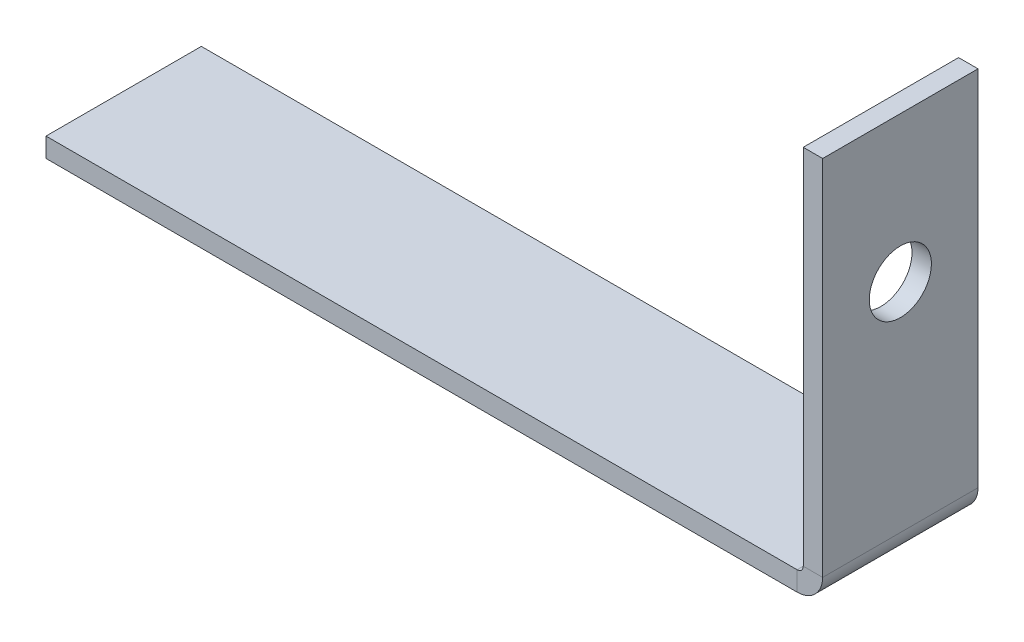
from build123d import *

# Parameters (mm, degrees)
SKETCH2_W                    = 127
SKETCH2_H                    = 25.4
BASE_FLANGE1_DEPTH           = 3.175
EDGE_FLANGE1_STRIP_W         = 14.7
EDGE_FLANGE1_STRIP_H         = 3.175
EDGE_FLANGE1_STRIP_CUT_DEPTH = 25.4
EDGE_FLANGE1_DEPTH           = 25.4
CUT_EXTRUDE1_REACH           = 144.875
SKETCH10_R                   = 5.08


# Sheet-metal steps are written as plain solids
with BuildPart() as part:
    # Sketch2 → Base-Flange1 (new body)
    with BuildSketch(Plane(origin=(0, 0, 0), x_dir=(1, 0, 0), z_dir=(0, 1, 0))):
        with Locations((63.5, 12.7)):
            Rectangle(SKETCH2_W, SKETCH2_H)
    extrude(amount=-BASE_FLANGE1_DEPTH)

    # Edge-Flange1 strip (across the edge) → Edge-Flange1 strip cut (cut)
    with BuildSketch(Plane(origin=(127, 0, 0), x_dir=(-1, 0, 0), z_dir=(0, 0, -1))):
        with Locations((-3.175, -1.5875)):
            Rectangle(EDGE_FLANGE1_STRIP_W, EDGE_FLANGE1_STRIP_H)
    extrude(amount=EDGE_FLANGE1_STRIP_CUT_DEPTH, mode=Mode.SUBTRACT)

    # Edge-Flange1 section (across the edge) → Edge-Flange1 (add)
    with BuildSketch(Plane(origin=(127, 0, 0), x_dir=(-1, 0, 0), z_dir=(0, 0, -1))):
        with BuildLine():
            Line((0, 1), (0, 60.325))
            Line((0, 60.325), (3.175, 60.325))
            Line((3.175, 60.325), (3.175, 1))
            ThreePointArc((3.175, 1), (3.467893219, 0.292893219), (4.175, 0))
            Line((4.175, 0), (4.175, -3.175))
            ThreePointArc((4.175, -3.175), (1.222829189, -1.952170811), (0, 1))
        make_face()
    extrude(amount=EDGE_FLANGE1_DEPTH)

    # Sketch10 → Cut-Extrude1 (cut, up to next)
    with BuildSketch(Plane(origin=(127, 0, 0), x_dir=(0, 0, -1), z_dir=(1, 0, 0)), mode=Mode.PRIVATE) as cut_extrude1_sk1:
        with Locations(Location((12.7, 36.5125, 0), (0, 0, 90))):
            Circle(SKETCH10_R)
    cut_extrude1_tool1 = extrude(cut_extrude1_sk1.sketch, amount=-CUT_EXTRUDE1_REACH, mode=Mode.PRIVATE) & part.part
    add(cut_extrude1_tool1.solids().sort_by_distance((127, 36.5125, -12.7))[0], mode=Mode.SUBTRACT)


solid = part.part
